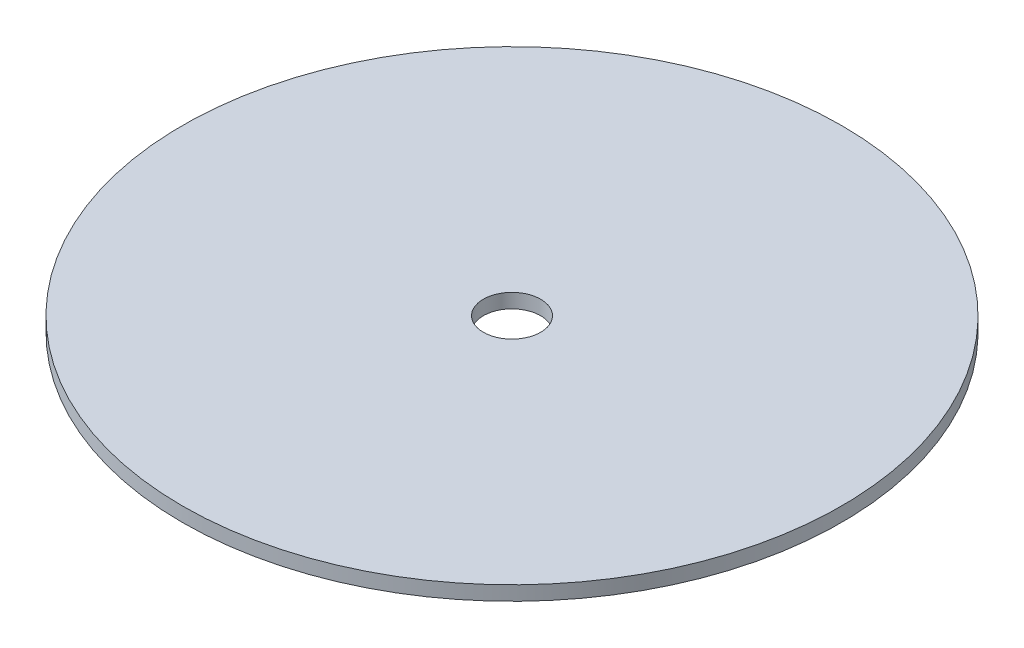
from build123d import *

# Parameters (mm, degrees)
SKETCH1_R           = 73.029292346
BOSS_EXTRUDE1_DEPTH = 3.175
SKETCH8_R           = 6.35
CUT_EXTRUDE3_DEPTH  = 16.256


with BuildPart() as part:
    # Sketch1 → Boss-Extrude1 (new body)
    with BuildSketch(Plane(origin=(0, 0, 0), x_dir=(1, 0, 0), z_dir=(0, 1, 0))):
        Circle(SKETCH1_R)
    extrude(amount=BOSS_EXTRUDE1_DEPTH)

    # Sketch8 → Cut-Extrude3 (cut)
    with BuildSketch(Plane(origin=(0, 3.175, 0), x_dir=(1, 0, 0), z_dir=(0, 1, 0))):
        Circle(SKETCH8_R)
    extrude(amount=-CUT_EXTRUDE3_DEPTH, mode=Mode.SUBTRACT)


solid = part.part
